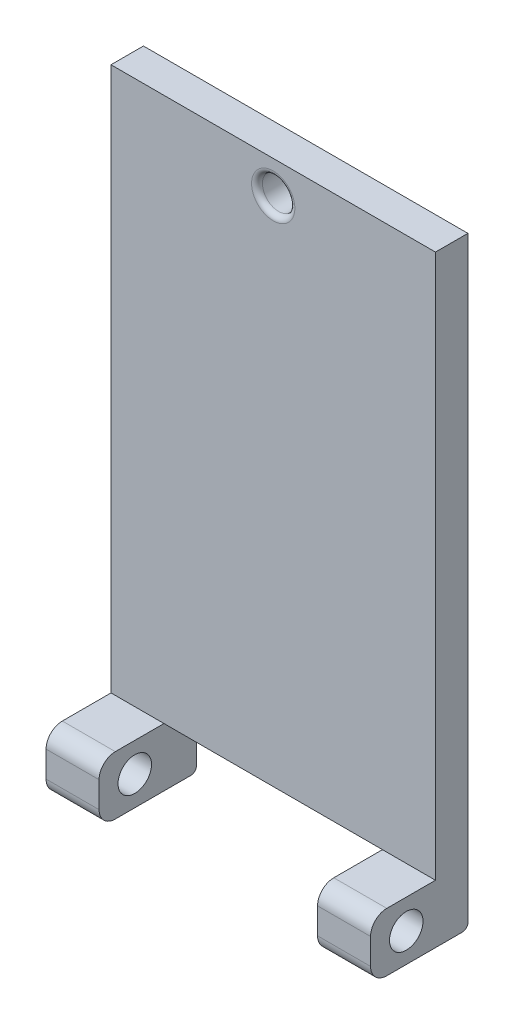
from build123d import *

# Parameters (mm, degrees)
SKETCH1_W               = 30
SKETCH1_H               = 55.7
BOSS_EXTRUDE1_DEPTH     = 3
SKETCH2_W               = 4.9
SKETCH2_H               = 5.4
BOSS_EXTRUDE2_DEPTH     = 6
SKETCH3_R               = 1.55
CUT_EXTRUDE1_DEPTH      = 42.912080597
SKETCH4_R               = 1.5
CUT_EXTRUDE2_DEPTH      = 10
FILLET3_R               = 0.5
FILLET4_R               = 0.5
CUT_EXTRUDE4_DEPTH      = 33.196622494
CUT_EXTRUDE4_DEPTH_BACK = 10
SKETCH5_W               = 20.2
SKETCH5_H               = 7.880641118
FILLET5_R               = 1.5


with BuildPart() as part:
    # Sketch1 → Boss-Extrude1 (new body)
    with BuildSketch(Plane.XY):
        Rectangle(SKETCH1_W, SKETCH1_H)
    extrude(amount=BOSS_EXTRUDE1_DEPTH)

    # Sketch2 → Boss-Extrude2 (add)
    with BuildSketch(Plane.XY.offset(3)):
        with Locations((-12.55, -25.15)):
            Rectangle(SKETCH2_W, SKETCH2_H)
    boss_extrude2 = extrude(amount=BOSS_EXTRUDE2_DEPTH)

    # Sketch3 → Cut-Extrude1 (cut, through all)
    with BuildSketch(Plane.ZY.offset(15)):
        with Locations((5.7, -25.15)):
            Circle(SKETCH3_R)
    cut_extrude1 = extrude(amount=-CUT_EXTRUDE1_DEPTH, mode=Mode.SUBTRACT)

    # Mirror1: Boss-Extrude2, Cut-Extrude1 across plane
    add(boss_extrude2.mirror(Plane(origin=(0, 0, 0), x_dir=(0, 0, 1), z_dir=(1, 0, 0))))
    add(cut_extrude1.mirror(Plane(origin=(0, 0, 0), x_dir=(0, 0, 1), z_dir=(1, 0, 0))), mode=Mode.SUBTRACT)

    # Sketch4 → Cut-Extrude2 (cut)
    with BuildSketch(Plane.XY.offset(3)):
        with Locations((0, 24.85)):
            Circle(SKETCH4_R)
    extrude(amount=-CUT_EXTRUDE2_DEPTH, mode=Mode.SUBTRACT)

    # Fillet3
    fillet3_edges = [part.edges().sort_by_distance(p)[0] for p in [
        (-1.5, 24.85, 0),
        (-1.5, 24.85, 3),
    ]]
    fillet(fillet3_edges, radius=FILLET3_R)

    # Fillet4
    fillet4_edges = [part.edges().sort_by_distance(p)[0] for p in [
        (0, -27.85, 0),
        (0, -27.85, 3),
    ]]
    fillet(fillet4_edges, radius=FILLET4_R)

    # Sketch5 → Cut-Extrude4 (cut, two sides: drawn at the far end of the back side and taken through both)
    with BuildSketch(Plane.XY.offset(3).offset(-CUT_EXTRUDE4_DEPTH_BACK)):
        with Locations((0, -26.390320559)):
            Rectangle(SKETCH5_W, SKETCH5_H)
    extrude(amount=CUT_EXTRUDE4_DEPTH + CUT_EXTRUDE4_DEPTH_BACK, mode=Mode.SUBTRACT)

    # Fillet5
    fillet5_edges = [part.edges().sort_by_distance(p)[0] for p in [
        (12.55, -27.85, 9),
        (12.55, -22.45, 9),
        (-12.55, -27.85, 9),
        (-12.55, -22.45, 9),
    ]]
    fillet(fillet5_edges, radius=FILLET5_R)


solid = part.part
